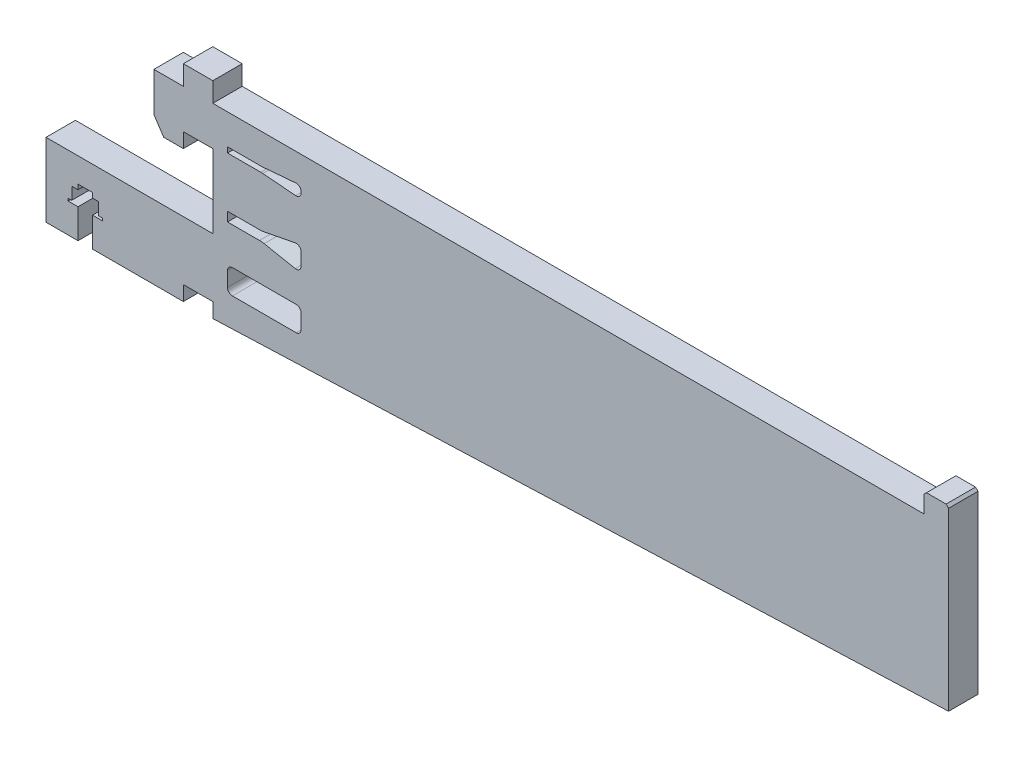
from build123d import *

# Parameters (mm, degrees)
SKETCH1_W           = 15
SKETCH1_H           = 5
BOSS_EXTRUDE1_DEPTH = 6
CHAMFER1_SIZE       = 3
CHAMFER1_SIZE2      = 2
FILLET1_R           = 1
FILLET2_R           = 5
CHAMFER2_SIZE       = 0.5


with BuildPart() as part:
    # Sketch1 → Boss-Extrude1 (new body)
    with BuildSketch(Plane.XY):
        Polygon((-17.5, -7), (16.5, -7), (16.5, 8), (10.5, 8), (10.5, 5), (4.5, 5), (4.5, 16), (10.5, 16), (10.5, 20), (16.5, 20), (16.5, 16), (161.5, 16), (161.5, 20), (166.5, 20), (166.5, -16.342859565), (16.5, -22), (16.5, -19), (10.5, -19), (10.5, -22), (-8.02, -22), (-8.02, -16), (-6, -16), (-6, -15.5), (-6.75, -15.5), (-6.75, -13), (-8.02, -13), (-8.02, -12), (-10.98, -12), (-10.98, -13), (-12.25, -13), (-12.25, -15.5), (-13, -15.5), (-13, -16), (-10.98, -16), (-10.98, -22), (-17.5, -22), align=None)
        Polygon((19.5, -3.45), (19.5, -1.55), (26.5, -1.55), (34.5, 0), (34.5, -5), (26.5, -3.45), align=None, mode=Mode.SUBTRACT)
        with Locations((27, -13.5)):
            Rectangle(SKETCH1_W, SKETCH1_H, mode=Mode.SUBTRACT)
        Polygon((19.5, 8.726722117), (19.5, 9.826722117), (26.5, 9.826722117), (34.5, 10.487607038), (34.5, 8.065837195), (26.5, 8.726722117), align=None, mode=Mode.SUBTRACT)
    extrude(amount=BOSS_EXTRUDE1_DEPTH)

    # Chamfer1
    chamfer1_edges = [part.edges().sort_by_distance(p)[0] for p in [
        (4.5, 5, 3),
    ]]
    chamfer1_side = [part.faces().sort_by_distance(p)[0] for p in [
        (4.5, 10.5, 3),
    ]]
    chamfer(chamfer1_edges, length=CHAMFER1_SIZE, length2=CHAMFER1_SIZE2, reference=chamfer1_side[0])

    # Fillet1
    fillet1_edges = [part.edges().sort_by_distance(p)[0] for p in [
        (19.5, -16, 3),
        (34.5, -16, 3),
        (34.5, -11, 3),
        (19.5, -11, 3),
        (34.5, 8.065837195, 3),
        (34.5, 10.487607038, 3),
        (34.5, -5, 3),
        (34.5, 0, 3),
    ]]
    fillet(fillet1_edges, radius=FILLET1_R)

    # Fillet2
    # the kernel refuses this fillet: 5 mm, written as the material it takes off along each edge
    with BuildSketch(Plane(origin=(26.5, 8.726722117, -0.515438436), x_dir=(0.9966051096378002, -0.08233016120370525, 0), z_dir=(0, 0, 1)), Plane(origin=(26.5, 9.826722117, -0.515438436), x_dir=(-1, 0, 0), z_dir=(0, 0, 1))) as fillet2_piece_1:
        with BuildLine():
            CenterArc((FILLET2_R * 0.041235074881, -FILLET2_R), FILLET2_R, 90, 4.722516116)
            Line((-FILLET2_R * 0.0410950863227, -FILLET2_R * 0.0033948903622), (0, 0))
            Line((0, 0), (FILLET2_R * 0.041235074881, 0))
        make_face()
    extrude(amount=7.030876872, mode=Mode.SUBTRACT)
    with BuildSketch(Plane(origin=(26.5, -3.45, -1.199781563), x_dir=(0.9817429059156794, -0.19021268802116595, 0), z_dir=(0, 0, 1)), Plane(origin=(26.5, -1.55, -1.199781563), x_dir=(-1, 0, 0), z_dir=(0, 0, 1))) as fillet2_piece_2:
        with BuildLine():
            CenterArc((FILLET2_R * 0.0959825250053, -FILLET2_R), FILLET2_R, 90, 10.965196685)
            Line((-FILLET2_R * 0.0942301630158, -FILLET2_R * 0.0182570940843), (0, 0))
            Line((0, 0), (FILLET2_R * 0.0959825250053, 0))
        make_face()
    extrude(amount=8.399563125, mode=Mode.SUBTRACT)

    # Chamfer2
    chamfer2_edges = [part.edges().sort_by_distance(p)[0] for p in [
        (161.5, 20, 3),
        (166.5, 20, 3),
    ]]
    chamfer(chamfer2_edges, length=CHAMFER2_SIZE)


solid = part.part
